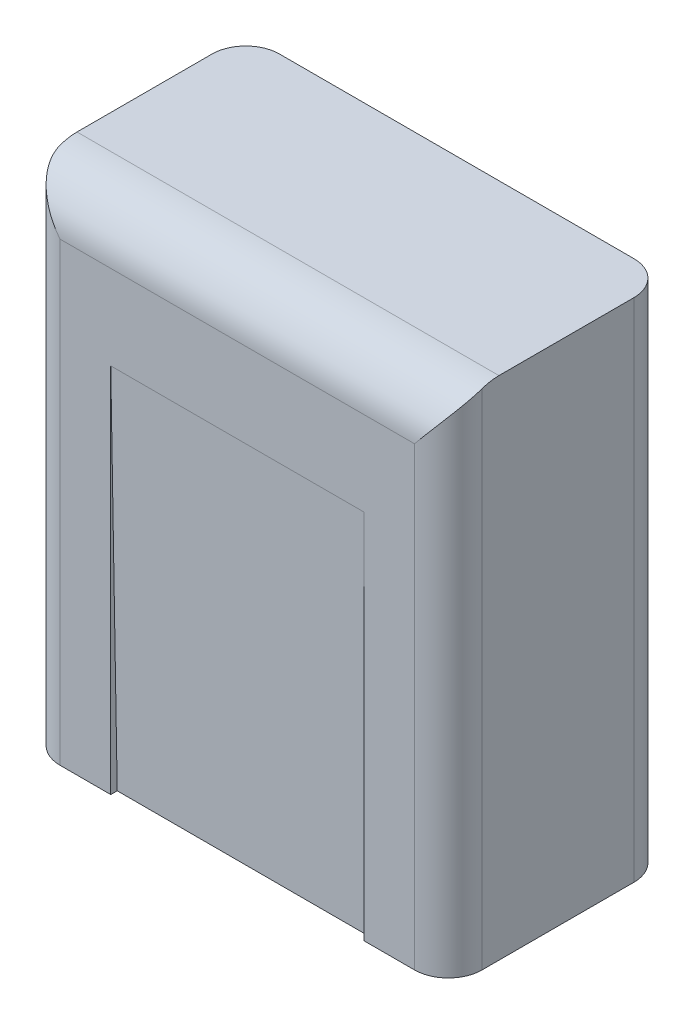
from build123d import *

# Parameters (mm, degrees)
SKETCH1_W                   = 25
SKETCH1_H                   = 13
BOSS_EXTRUDE1_DEPTH         = 30
FILLET1_R                   = 2
FILLET2_R                   = 3
M6_TAPPED_HOLE1_D           = 5
M6_TAPPED_HOLE1_DEPTH       = 17
M6_TAPPED_HOLE1_CSINK_D     = 6.05
M6_TAPPED_HOLE1_CSINK_ANGLE = 90
M6_TAPPED_HOLE1_TIP         = 1.502151548
CUT_EXTRUDE1_DEPTH          = 7.5


with BuildPart() as part:
    # Sketch1 → Boss-Extrude1 (new body)
    with BuildSketch(Plane(origin=(0, 0, 0), x_dir=(1, 0, 0), z_dir=(0, 1, 0))):
        Rectangle(SKETCH1_W, SKETCH1_H)
    extrude(amount=-BOSS_EXTRUDE1_DEPTH)

    # Fillet1
    fillet1_edges = [part.edges().sort_by_distance(p)[0] for p in [
        (12.5, -15, 6.5),
        (-12.5, -15, 6.5),
        (-12.5, -15, -6.5),
        (12.5, -15, -6.5),
    ]]
    fillet(fillet1_edges, radius=FILLET1_R)

    # Fillet2
    # the kernel refuses this fillet: 3 mm, written as the material it takes off along each edge
    with BuildSketch(Plane(origin=(-18, 0, 6.5), x_dir=(0, -1, 0), z_dir=(1, 0, 0))) as fillet2_piece_1:
        with BuildLine():
            CenterArc((FILLET2_R, FILLET2_R), FILLET2_R, 180, 90)
            Line((0, FILLET2_R), (0, 0))
            Line((0, 0), (FILLET2_R, 0))
        make_face()
    extrude(amount=36, mode=Mode.SUBTRACT)

    # M6 Tapped Hole1
    with Locations(Plane(origin=(0, -30, 0), x_dir=(-1, 0, 0), z_dir=(0, -1, 0))):
        with Locations((-5, 0), (5, 0)):
            CounterSinkHole(M6_TAPPED_HOLE1_D / 2, M6_TAPPED_HOLE1_CSINK_D / 2, depth=M6_TAPPED_HOLE1_DEPTH, counter_sink_angle=M6_TAPPED_HOLE1_CSINK_ANGLE)
            with Locations((0, 0, -(M6_TAPPED_HOLE1_DEPTH + M6_TAPPED_HOLE1_TIP / 2))):  # 118° drill point
                Cone(0, M6_TAPPED_HOLE1_D / 2, M6_TAPPED_HOLE1_TIP, mode=Mode.SUBTRACT)

    # Sketch5 → Cut-Extrude1 (cut, symmetric)
    with BuildSketch(Plane(origin=(0, 0, 0), x_dir=(0, 0, -1), z_dir=(1, 0, 0))):
        Polygon((-6.5, -8), (-6.115988572, -30), (-6.5, -30), align=None)
    extrude(amount=CUT_EXTRUDE1_DEPTH, both=True, mode=Mode.SUBTRACT)


solid = part.part
